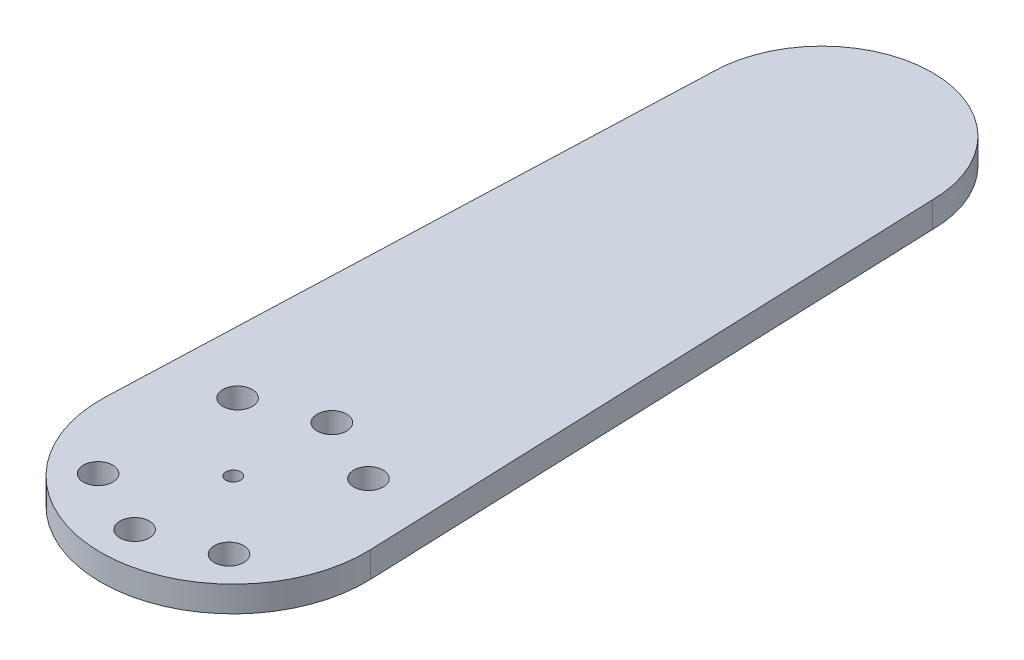
from build123d import *

# Parameters (mm, degrees)
SKETCH_1_R          = 1
EXTRUDE_1_DEPTH     = 3.5
SKETCH_2_R          = 2
CUT_EXTRUDE_1_DEPTH = 97.753552906


with BuildPart() as part:
    # Эскиз1 → Вытянуть1 (new body)
    with BuildSketch(Plane(origin=(0, 0, 0), x_dir=(1, 0, 0), z_dir=(0, 1, 0))):
        with BuildLine():
            Line((-15, 80), (-17.987249423, 0.677390733))
            ThreePointArc((-17.987249423, 0.677390733), (0, -18), (17.987249423, 0.677390733))
            Line((17.987249423, 0.677390733), (15, 80))
            ThreePointArc((15, 80), (0, 95), (-15, 80))
        make_face()
        Circle(SKETCH_1_R, mode=Mode.SUBTRACT)
    extrude(amount=EXTRUDE_1_DEPTH)

    # Эскиз2 → Вырез-Вытянуть1 (cut, through all)
    with BuildSketch(Plane.XZ):
        with Locations((-0.408986403, 12.99356495)):
            Circle(SKETCH_2_R)
        with Locations((-9.477034947, 8.898640829)):
            Circle(SKETCH_2_R)
        with Locations((8.898640829, 9.477034947)):
            Circle(SKETCH_2_R)
        with Locations((9.477034947, -8.898640829)):
            Circle(SKETCH_2_R)
        with Locations((0.408986403, -12.99356495)):
            Circle(SKETCH_2_R)
        with Locations((-8.898640829, -9.477034947)):
            Circle(SKETCH_2_R)
    extrude(amount=-CUT_EXTRUDE_1_DEPTH, mode=Mode.SUBTRACT)


solid = part.part
